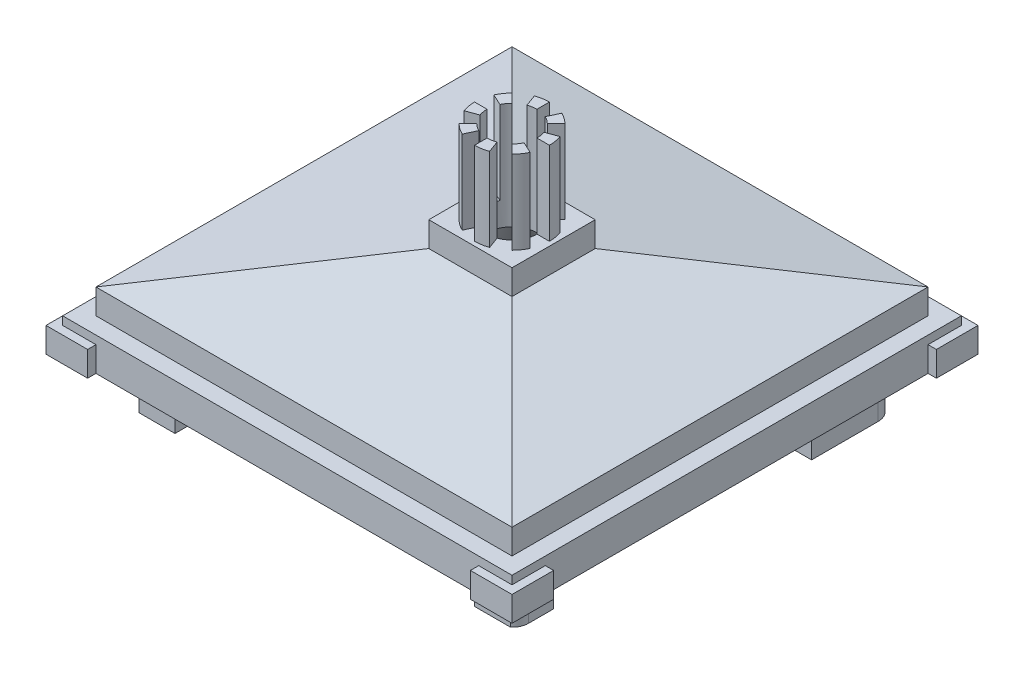
from build123d import *
from build123d.topology import SkipClean

# Parameters (mm, degrees)
SKETCH_1_W          = 54
SKETCH_1_H          = 54
EXTRUDE_1_DEPTH     = 4
SKETCH_2_W          = 50
SKETCH_2_H          = 50
EXTRUDE_2_DEPTH     = 8
CHAMFER_1_SIZE      = 5
CHAMFER_1_SIZE_2    = 25
SKETCH_3_W          = 56
SKETCH_3_H          = 56
EXTRUDE_3_DEPTH     = 3
SKETCH_4_W          = 46
SKETCH_4_H          = 1
SKETCH_4_W_2        = 1
SKETCH_4_H_2        = 46
CUT_EXTRUDE_1_DEPTH = 3
EXTRUDE_START       = 10
SKETCH_5_W          = 10
SKETCH_5_H          = 10
EXTRUDE_4_DEPTH     = 4
EXTRUDE_5_DEPTH     = 10
SKETCH_10_W         = 46
SKETCH_10_H         = 46
CUT_EXTRUDE_2_DEPTH = 4
SKETCH_12_R         = 3
CUT_EXTRUDE_3_DEPTH = 15
CHAMFER_2_SIZE      = 5
CHAMFER_2_SIZE2     = 7.140740034
CHAMFER_3_SIZE      = 5
CHAMFER_3_SIZE_2    = 20.3603283
SKETCH_13_W         = 5
SKETCH_13_H         = 5
EXTRUDE_6_DEPTH     = 10
SKETCH_14_W         = 5
SKETCH_14_H         = 10
EXTRUDE_7_DEPTH     = 10
FILLET_1_R          = 2
CUT_EXTRUDE_4_DEPTH = 6
SKETCH_16_W         = 12.181950641
SKETCH_16_H         = 4.017842963
CUT_EXTRUDE_5_DEPTH = 82.012344772


with BuildPart() as part:
    # Эскиз1 → Бобышка-Вытянуть1 (new body)
    with BuildSketch(Plane(origin=(0, 0, 0), x_dir=(1, 0, 0), z_dir=(0, 1, 0))):
        with Locations((27, 27)):
            Rectangle(SKETCH_1_W, SKETCH_1_H)
    extrude(amount=EXTRUDE_1_DEPTH)

    # Эскиз2 → Бобышка-Вытянуть2 (add)
    with BuildSketch(Plane(origin=(0, 4, 0), x_dir=(1, 0, 0), z_dir=(0, 1, 0))):
        with Locations((27, 27)):
            Rectangle(SKETCH_2_W, SKETCH_2_H)
    extrude(amount=EXTRUDE_2_DEPTH)

    # Фаска1
    # the kernel refuses this chamfer: 25, 5 mm, written as the material it takes off along each edge
    with BuildSketch(Plane(origin=(2, 12, -116.953302157), x_dir=(-0.18544098588999025, -0.9826554028509427, 0), z_dir=(0, 0, 1)), Plane(origin=(-62.953302157, 12, -2), x_dir=(0, -0.9826554028509427, 0.18544098588999025), z_dir=(1, 0, 0)), Plane(origin=(52, 12, 62.953302157), x_dir=(0.18544098588999086, -0.9826554028509427, 0), z_dir=(0, 0, -1)), Plane(origin=(116.953302157, 12, -52), x_dir=(0, -0.9826554028509427, -0.18544098588999086), z_dir=(-1, 0, 0))) as chamfer_1_piece_1:
        Polygon((CHAMFER_1_SIZE * 0.982655402851, CHAMFER_1_SIZE * 0.18544098589), (-CHAMFER_1_SIZE_2 * 0.18544098589, CHAMFER_1_SIZE_2 * 0.982655402851), (0, 0), align=None)
    extrude(amount=179.906604315, mode=Mode.SUBTRACT)

    # Эскиз3 → Бобышка-Вытянуть3 (add)
    with BuildSketch(Plane(origin=(0, 0, 0), x_dir=(1, 0, 0), z_dir=(0, 1, 0))):
        with Locations((27, 27)):
            Rectangle(SKETCH_3_W, SKETCH_3_H)
    extrude(amount=EXTRUDE_3_DEPTH)

    # Эскиз4 → Вырез-Вытянуть1 (cut)
    with BuildSketch(Plane(origin=(0, 3, 0), x_dir=(1, 0, 0), z_dir=(0, 1, 0))):
        with Locations((27, 54.5)):
            Rectangle(SKETCH_4_W, SKETCH_4_H)
        with Locations((-0.5, 27)):
            Rectangle(SKETCH_4_W_2, SKETCH_4_H_2)
        with Locations((54.5, 27)):
            Rectangle(SKETCH_4_W_2, SKETCH_4_H_2)
        with Locations((27, -0.5)):
            Rectangle(SKETCH_4_W, SKETCH_4_H)
    extrude(amount=-CUT_EXTRUDE_1_DEPTH, mode=Mode.SUBTRACT)

    # Эскиз5 → Бобышка-Вытянуть4 (add)
    with BuildSketch(Plane(origin=(0, 0, 0), x_dir=(1, 0, 0), z_dir=(0, 1, 0)).offset(EXTRUDE_START)):
        with Locations((27, 27)):
            Rectangle(SKETCH_5_W, SKETCH_5_H)
    extrude(amount=EXTRUDE_4_DEPTH)

    # Эскиз6 → Бобышка-Вытянуть5 (add)
    with BuildSketch(Plane(origin=(0, 14, 0), x_dir=(1, 0, 0), z_dir=(0, 1, 0))):
        with BuildLine():
            Line((27, 30), (27, 31.5))
            ThreePointArc((27, 31.5), (26.2185832, 31.431634889), (25.460909355, 31.228616794))
            Line((25.460909355, 31.228616794), (25.97393957, 29.819077862))
            ThreePointArc((25.97393957, 29.819077862), (26.479055467, 29.954423259), (27, 30))
        make_face()
        with BuildLine():
            Line((29.121320344, 29.121320344), (30.181980515, 30.181980515))
            ThreePointArc((30.181980515, 30.181980515), (29.581093964, 30.686184199), (28.901782178, 31.078385042))
            Line((28.901782178, 31.078385042), (28.267854785, 29.718923361))
            ThreePointArc((28.267854785, 29.718923361), (28.720729309, 29.457456133), (29.121320344, 29.121320344))
        make_face()
        with BuildLine():
            Line((30, 27), (31.5, 27))
            ThreePointArc((31.5, 27), (31.431634889, 27.7814168), (31.228616794, 28.539090645))
            Line((31.228616794, 28.539090645), (29.819077862, 28.02606043))
            ThreePointArc((29.819077862, 28.02606043), (29.954423259, 27.520944533), (30, 27))
        make_face()
        with BuildLine():
            Line((29.121320344, 24.878679656), (30.181980515, 23.818019485))
            ThreePointArc((30.181980515, 23.818019485), (30.686184199, 24.418906036), (31.078385042, 25.098217822))
            Line((31.078385042, 25.098217822), (29.718923361, 25.732145215))
            ThreePointArc((29.718923361, 25.732145215), (29.457456133, 25.279270691), (29.121320344, 24.878679656))
        make_face()
        with BuildLine():
            Line((27, 24), (27, 22.5))
            ThreePointArc((27, 22.5), (27.7814168, 22.568365111), (28.539090645, 22.771383206))
            Line((28.539090645, 22.771383206), (28.02606043, 24.180922138))
            ThreePointArc((28.02606043, 24.180922138), (27.520944533, 24.045576741), (27, 24))
        make_face()
        with BuildLine():
            Line((24.878679656, 24.878679656), (23.818019485, 23.818019485))
            ThreePointArc((23.818019485, 23.818019485), (24.418906036, 23.313815801), (25.098217822, 22.921614958))
            Line((25.098217822, 22.921614958), (25.732145215, 24.281076639))
            ThreePointArc((25.732145215, 24.281076639), (25.279270691, 24.542543867), (24.878679656, 24.878679656))
        make_face()
        with BuildLine():
            Line((24, 27), (22.5, 27))
            ThreePointArc((22.5, 27), (22.568365111, 26.2185832), (22.771383206, 25.460909355))
            Line((22.771383206, 25.460909355), (24.180922138, 25.97393957))
            ThreePointArc((24.180922138, 25.97393957), (24.045576741, 26.479055467), (24, 27))
        make_face()
        with BuildLine():
            Line((24.878679656, 29.121320344), (23.818019485, 30.181980515))
            ThreePointArc((23.818019485, 30.181980515), (23.313815801, 29.581093964), (22.921614958, 28.901782178))
            Line((22.921614958, 28.901782178), (24.281076639, 28.267854785))
            ThreePointArc((24.281076639, 28.267854785), (24.542543867, 28.720729309), (24.878679656, 29.121320344))
        make_face()
    extrude(amount=EXTRUDE_5_DEPTH)

    # Эскиз9 → Повернуть1 (revolve)
    with BuildSketch(Plane(origin=(27, 0, 0), x_dir=(0, 0, -1), z_dir=(1, 0, 0))):
        with BuildLine():
            Line((27, 24), (33, 24))
            Line((33, 24), (28.599558116, 25.80595603))
            ThreePointArc((28.599558116, 25.80595603), (27.95267314, 26.60779708), (27, 27))
            Line((27, 27), (27, 24))
        make_face()
    revolve(axis=Axis((27, 24, -27), (0, 1, 0)))

    # Эскиз10 → Вырез-Вытянуть2 (cut)
    with BuildSketch(Plane(origin=(0, 0, 0), x_dir=(1, 0, 0), z_dir=(0, 1, 0))):
        with Locations((27, 27)):
            Rectangle(SKETCH_10_W, SKETCH_10_H)
    extrude(amount=CUT_EXTRUDE_2_DEPTH, mode=Mode.SUBTRACT)

    # Эскиз12 → Вырез-Вытянуть3 (cut)
    with SkipClean():  # the faces are left unmerged after this step: merging them gives an invalid solid
        with BuildSketch(Plane(origin=(0, 0, 0), x_dir=(1, 0, 0), z_dir=(0, 1, 0))):
            with Locations(Location((27, 27, 0), (0, 0, 270))):
                Circle(SKETCH_12_R)
        extrude(amount=CUT_EXTRUDE_3_DEPTH, mode=Mode.SUBTRACT)
    add(part.part.scale(1), mode=Mode.REPLACE)  # the faces are merged on a copy

    # Фаска2
    chamfer_2_edges = [part.edges().sort_by_distance(p)[0] for p in [
        (27, 4, -30),
    ]]
    chamfer_2_side = [part.faces().sort_by_distance(p)[0] for p in [
        (27, 4, -49.349461761),
    ]]
    chamfer(chamfer_2_edges, length=CHAMFER_2_SIZE, length2=CHAMFER_2_SIZE2, reference=chamfer_2_side[0])

    # Фаска3
    # the kernel refuses this chamfer: 20.3603283, 5 mm, written as the material it takes off along each edge
    with BuildSketch(Plane(origin=(27, 4, -27), x_dir=(0, 0, 1), z_dir=(1, 0, 0))) as chamfer_3_piece_1_section:
        Polygon((8 - CHAMFER_3_SIZE * 0.573576436351, -CHAMFER_3_SIZE * 0.819152044289), (8 + CHAMFER_3_SIZE_2, 0), (8, 0), align=None)
    chamfer_3_piece_1 = revolve(axis=Axis((27, 4, -27), (0, -1, 0)), mode=Mode.PRIVATE)
    chamfer_3_piece_1 = split(chamfer_3_piece_1, bisect_by=Plane(origin=(27, 5.887283675, -50), z_dir=(0, 0, 1)), keep=Keep.TOP, mode=Mode.PRIVATE)
    chamfer_3_piece_1 = split(chamfer_3_piece_1, bisect_by=Plane(origin=(4, 5.887283675, -43.717905574), z_dir=(1, 0, 0)), keep=Keep.TOP, mode=Mode.PRIVATE)
    chamfer_3_piece_1 = split(chamfer_3_piece_1, bisect_by=Plane(origin=(50, 5.887283675, -43.717905574), z_dir=(-1, 0, 0)), keep=Keep.TOP, mode=Mode.PRIVATE)
    chamfer_3_piece_1 = split(chamfer_3_piece_1, bisect_by=Plane(origin=(27, 5.887283675, -4), z_dir=(0, 0, -1)), keep=Keep.TOP, mode=Mode.PRIVATE)
    add(chamfer_3_piece_1, mode=Mode.SUBTRACT)

    # Эскиз13 → Бобышка-Вытянуть6 (add)
    with SkipClean():  # the faces are left unmerged after this step: merging them gives an invalid solid
        with BuildSketch(Plane.XZ.offset(-4)):
            with Locations((6.5, -6.5)):
                Rectangle(SKETCH_13_W, SKETCH_13_H)
            with Locations((47.5, -6.5)):
                Rectangle(SKETCH_13_W, SKETCH_13_H)
        extrude(amount=EXTRUDE_6_DEPTH)

    # Эскиз14 → Бобышка-Вытянуть7 (add)
    with SkipClean():  # the faces are left unmerged after this step: merging them gives an invalid solid
        with BuildSketch(Plane.XZ.offset(-4)):
            with Locations((47.5, -45)):
                Rectangle(SKETCH_14_W, SKETCH_14_H)
            with Locations((6.5, -45)):
                Rectangle(SKETCH_14_W, SKETCH_14_H)
        extrude(amount=EXTRUDE_7_DEPTH)

    # Скругление1
    fillet_1_edges = [part.edges().sort_by_distance(p)[0] for p in [
        (4, -3, -4),
        (50, -3, -4),
        (50, -3, -50),
        (4, -3, -50),
    ]]
    fillet(fillet_1_edges, radius=FILLET_1_R)

    # Эскиз15 → Вырез-Вытянуть4 (cut)
    with BuildSketch(Plane.XZ.offset(6)):
        Polygon((51, -4.5), (4.5, -4.5), (4.5, -51), (2.5, -51), (2.5, -2.5), (51, -2.5), align=None)
    extrude(amount=-CUT_EXTRUDE_4_DEPTH, mode=Mode.SUBTRACT)

    # Эскиз16 → Вырез-Вытянуть5 (cut, through all)
    with BuildSketch(Plane.ZY.offset(-2)):
        with Locations((-26.909024679, 26.008921482)):
            Rectangle(SKETCH_16_W, SKETCH_16_H)
    extrude(amount=-CUT_EXTRUDE_5_DEPTH, mode=Mode.SUBTRACT)


solid = part.part
